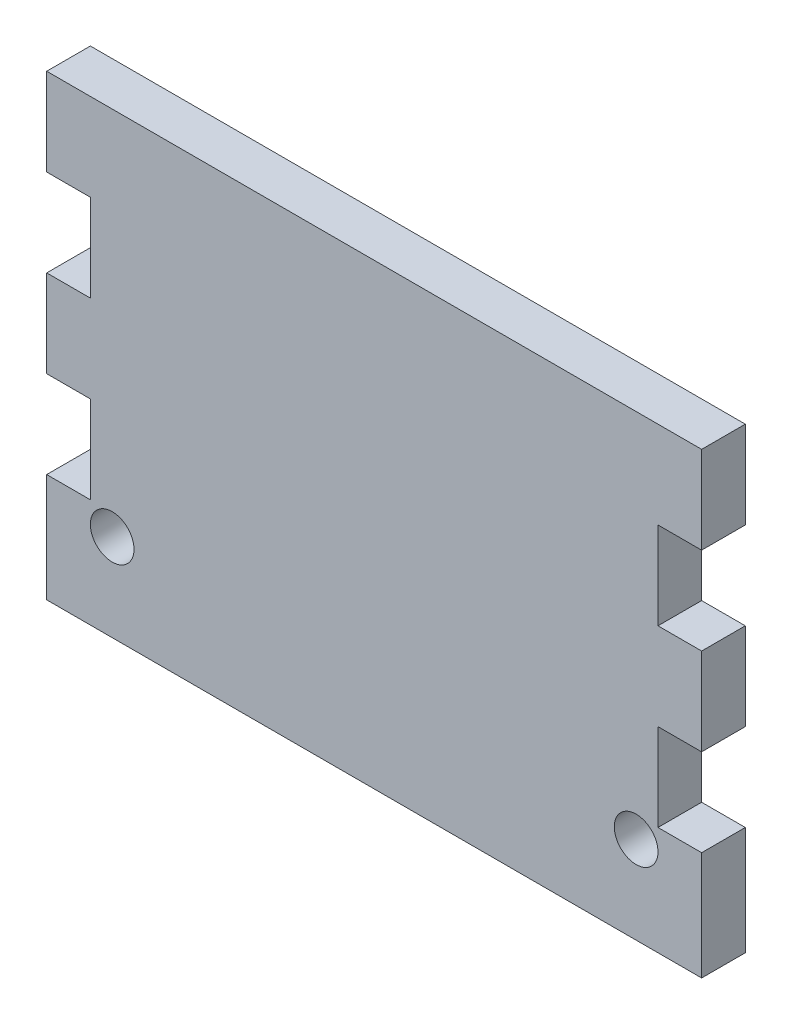
from build123d import *

# Parameters (mm, degrees)
SKETCH2_W           = 95.25
SKETCH2_H           = 305.964286483
BOSS_EXTRUDE1_DEPTH = 6.35
SKETCH3_W           = 6.35
SKETCH3_H           = 12.7
CUT_EXTRUDE1_DEPTH  = 321.51057643
LPATTERN1_COUNT     = 12
LPATTERN1_PITCH     = 25.4
SKETCH4_W           = 15.875
SKETCH4_H           = 6.374255968
SKETCH4_W_2         = 12.7
CUT_EXTRUDE2_DEPTH  = 321.51057643
SKETCH5_W           = 12.7
SKETCH5_H           = 6.929808982
CUT_EXTRUDE3_DEPTH  = 321.51057643
SKETCH8_W           = 95.25
SKETCH8_H           = 0.555553013
CUT_EXTRUDE5_DEPTH  = 321.51057643
SKETCH9_W           = 69.85
SKETCH9_H           = 248.088941691
BOSS_EXTRUDE3_DEPTH = 6.35
CUT_EXTRUDE8_DEPTH  = 321.51057643
FILL_PATTERN1_DEPTH = 6.35
SKETCH9_2_W         = 69.85
SKETCH9_2_H         = 248.088941691
CUT_EXTRUDE9_DEPTH  = 6.35
SKETCH14_W          = 69.85
SKETCH14_H          = 51.238941691
BOSS_EXTRUDE4_DEPTH = 6.35
SKETCH15_W          = 69.85
SKETCH15_H          = 44.888941691
CUT_EXTRUDE11_DEPTH = 6.35
CHAMFER1_SIZE       = 3.175
SKETCH17_W          = 69.85
SKETCH17_H          = 6.35
BOSS_EXTRUDE5_DEPTH = 6.35
SKETCH18_W          = 69.85
SKETCH18_H          = 44.45
CUT_EXTRUDE12_DEPTH = 321.51057643
CHAMFER2_SIZE       = 3.175
SKETCH19_W          = 95.25
SKETCH19_H          = 105.239375395
BOSS_EXTRUDE6_DEPTH = 6.35
LPATTERN2_COUNT     = 5
LPATTERN2_PITCH     = 25.4
SKETCH20_R          = 3.175
CUT_EXTRUDE13_DEPTH = 321.51057643
SKETCH22_R          = 1.75
CUT_EXTRUDE14_DEPTH = 321.51057643
SKETCH23_W          = 95.25
SKETCH23_H          = 344.064286483
CUT_EXTRUDE15_DEPTH = 321.51057643


# Read off the part's stored shape, not the designer's step: Fill Pattern1
with BuildPart() as part:
    # Sketch2 → Boss-Extrude1 (new body)
    with BuildSketch(Plane.XY):
        with Locations((47.625, 152.982143242)):
            Rectangle(SKETCH2_W, SKETCH2_H)
    extrude(amount=BOSS_EXTRUDE1_DEPTH)

    # Sketch3 → Cut-Extrude1 (cut, through all)
    with BuildSketch(Plane.XY.offset(6.35)):
        with Locations((3.175, 19.05)):
            Rectangle(SKETCH3_W, SKETCH3_H)
        with Locations((92.075, 19.05)):
            Rectangle(SKETCH3_W, SKETCH3_H)
    cut_extrude1 = extrude(amount=-CUT_EXTRUDE1_DEPTH, mode=Mode.SUBTRACT)

    # LPattern1: Cut-Extrude1 ×12
    with Locations(*[(0, i * LPATTERN1_PITCH, 0) for i in range(1, LPATTERN1_COUNT)]):
        add(cut_extrude1, mode=Mode.SUBTRACT)

    # Sketch4 → Cut-Extrude2 (cut, through all)
    with BuildSketch(Plane.XY.offset(6.35)):
        with Locations((7.9375, 302.777158499)):
            Rectangle(SKETCH4_W, SKETCH4_H)
        with Locations((34.925, 302.777158499)):
            Rectangle(SKETCH4_W_2, SKETCH4_H)
        with Locations((87.3125, 302.777158499)):
            Rectangle(SKETCH4_W, SKETCH4_H)
        with Locations((60.325, 302.777158499)):
            Rectangle(SKETCH4_W_2, SKETCH4_H)
    extrude(amount=-CUT_EXTRUDE2_DEPTH, mode=Mode.SUBTRACT)

    # Sketch5 → Cut-Extrude3 (cut, through all)
    with BuildSketch(Plane.XY.offset(6.35)):
        with Locations((22.225, 35.336184333)):
            Rectangle(SKETCH5_W, SKETCH5_H)
        with Locations((47.625, 35.336184333)):
            Rectangle(SKETCH5_W, SKETCH5_H)
        with Locations((73.025, 35.336184333)):
            Rectangle(SKETCH5_W, SKETCH5_H)
    extrude(amount=-CUT_EXTRUDE3_DEPTH, mode=Mode.SUBTRACT)

    # Sketch8 → Cut-Extrude5 (cut, through all)
    with BuildSketch(Plane.XY.offset(6.35)):
        with Locations((47.625, 0.277776507)):
            Rectangle(SKETCH8_W, SKETCH8_H)
    extrude(amount=-CUT_EXTRUDE5_DEPTH, mode=Mode.SUBTRACT)

    # Sketch9<2> → Cut-Extrude9 (cut)
    with BuildSketch(Plane.XY.offset(6.35)):
        with Locations((47.625, 169.195559669)):
            Rectangle(SKETCH9_2_W, SKETCH9_2_H)
    extrude(amount=-CUT_EXTRUDE9_DEPTH, mode=Mode.SUBTRACT)


with BuildPart() as body_2:
    # Sketch9 → Boss-Extrude3 (new body)
    with BuildSketch(Plane.XY.offset(6.35)):
        with Locations((47.625, 169.195559669)):
            Rectangle(SKETCH9_W, SKETCH9_H)
    extrude(amount=-BOSS_EXTRUDE3_DEPTH)

    # Sketch12 → Cut-Extrude8 (cut, through all)
    with BuildSketch(Plane.XY.offset(6.35)):
        Polygon((42.125738686, 280.540030515), (36.626477372, 271.015030515), (42.125738686, 261.490030515), (53.124261314, 261.490030515), (58.623522628, 271.015030515), (53.124261314, 280.540030515), align=None)
    extrude(amount=-CUT_EXTRUDE8_DEPTH, mode=Mode.SUBTRACT)

    # Fill Pattern1 outline → Fill Pattern1 (cut)
    with BuildSketch(Plane.XY):
        Polygon((75.12130657, 223.390030515), (80.620567884, 232.915030515), (75.12130657, 242.440030515), (64.122783942, 242.440030515), (58.623522628, 232.915030515), (64.122783942, 223.390030515), align=None)
        Polygon((20.12869343, 223.390030515), (31.127216058, 223.390030515), (36.626477372, 232.915030515), (31.127216058, 242.440030515), (20.12869343, 242.440030515), (14.629432116, 232.915030515), align=None)
        Polygon((12.7, 198.156904969), (12.7, 191.47315606), (14.629432116, 194.815030515), align=None)
        Polygon((14.629432116, 169.415030515), (12.7, 172.756904969), (12.7, 166.07315606), align=None)
        Polygon((12.7, 223.556904969), (12.7, 216.87315606), (14.629432116, 220.215030515), align=None)
        Polygon((14.629432116, 144.015030515), (12.7, 147.356904969), (12.7, 140.67315606), align=None)
        Polygon((12.7, 248.956904969), (12.7, 242.27315606), (14.629432116, 245.615030515), align=None)
        Polygon((14.629432116, 118.615030515), (12.7, 121.956904969), (12.7, 115.27315606), align=None)
        Polygon((12.7, 274.356904969), (12.7, 267.67315606), (14.629432116, 271.015030515), align=None)
        Polygon((14.629432116, 93.215030515), (12.7, 96.556904969), (12.7, 89.87315606), align=None)
        Polygon((12.7, 293.240030515), (12.7, 293.07315606), (12.796345011, 293.240030515), align=None)
        Polygon((14.629432116, 67.815030515), (12.7, 71.156904969), (12.7, 64.47315606), align=None)
        Polygon((31.127216058, 293.240030515), (20.12869343, 293.240030515), (14.629432116, 283.715030515), (20.12869343, 274.190030515), (31.127216058, 274.190030515), (36.626477372, 283.715030515), align=None)
        Polygon((56.790435523, 293.240030515), (38.459564477, 293.240030515), (42.125738686, 286.890030515), (53.124261314, 286.890030515), align=None)
        Polygon((42.125738686, 51.940030515), (38.206141373, 45.151088824), (57.043858627, 45.151088824), (53.124261314, 51.940030515), align=None)
        Polygon((75.12130657, 293.240030515), (64.122783942, 293.240030515), (58.623522628, 283.715030515), (64.122783942, 274.190030515), (75.12130657, 274.190030515), (80.620567884, 283.715030515), align=None)
        Polygon((82.55, 45.756904969), (82.200231885, 45.151088824), (82.55, 45.151088824), align=None)
        Polygon((82.55, 293.240030515), (82.453654989, 293.240030515), (82.55, 293.07315606), align=None)
        Polygon((80.620567884, 67.815030515), (82.55, 64.47315606), (82.55, 71.156904969), align=None)
        Polygon((82.55, 267.67315606), (82.55, 274.356904969), (80.620567884, 271.015030515), align=None)
        Polygon((80.620567884, 93.215030515), (82.55, 89.87315606), (82.55, 96.556904969), align=None)
        Polygon((82.55, 242.27315606), (82.55, 248.956904969), (80.620567884, 245.615030515), align=None)
        Polygon((80.620567884, 118.615030515), (82.55, 115.27315606), (82.55, 121.956904969), align=None)
        Polygon((82.55, 216.87315606), (82.55, 223.556904969), (80.620567884, 220.215030515), align=None)
        Polygon((80.620567884, 144.015030515), (82.55, 140.67315606), (82.55, 147.356904969), align=None)
        Polygon((82.55, 191.47315606), (82.55, 198.156904969), (80.620567884, 194.815030515), align=None)
        Polygon((80.620567884, 169.415030515), (82.55, 166.07315606), (82.55, 172.756904969), align=None)
        Polygon((20.12869343, 248.790030515), (31.127216058, 248.790030515), (36.626477372, 258.315030515), (31.127216058, 267.840030515), (20.12869343, 267.840030515), (14.629432116, 258.315030515), align=None)
        Polygon((64.122783942, 267.840030515), (58.623522628, 258.315030515), (64.122783942, 248.790030515), (75.12130657, 248.790030515), (80.620567884, 258.315030515), (75.12130657, 267.840030515), align=None)
        Polygon((42.125738686, 236.090030515), (53.124261314, 236.090030515), (58.623522628, 245.615030515), (53.124261314, 255.140030515), (42.125738686, 255.140030515), (36.626477372, 245.615030515), align=None)
        Polygon((20.12869343, 197.990030515), (31.127216058, 197.990030515), (36.626477372, 207.515030515), (31.127216058, 217.040030515), (20.12869343, 217.040030515), (14.629432116, 207.515030515), align=None)
        Polygon((53.124261314, 204.340030515), (42.125738686, 204.340030515), (36.626477372, 194.815030515), (42.125738686, 185.290030515), (53.124261314, 185.290030515), (58.623522628, 194.815030515), align=None)
        Polygon((31.127216058, 166.240030515), (20.12869343, 166.240030515), (14.629432116, 156.715030515), (20.12869343, 147.190030515), (31.127216058, 147.190030515), (36.626477372, 156.715030515), align=None)
        Polygon((75.12130657, 197.990030515), (80.620567884, 207.515030515), (75.12130657, 217.040030515), (64.122783942, 217.040030515), (58.623522628, 207.515030515), (64.122783942, 197.990030515), align=None)
        Polygon((42.125738686, 210.690030515), (53.124261314, 210.690030515), (58.623522628, 220.215030515), (53.124261314, 229.740030515), (42.125738686, 229.740030515), (36.626477372, 220.215030515), align=None)
        Polygon((20.12869343, 172.590030515), (31.127216058, 172.590030515), (36.626477372, 182.115030515), (31.127216058, 191.640030515), (20.12869343, 191.640030515), (14.629432116, 182.115030515), align=None)
        Polygon((53.124261314, 178.940030515), (42.125738686, 178.940030515), (36.626477372, 169.415030515), (42.125738686, 159.890030515), (53.124261314, 159.890030515), (58.623522628, 169.415030515), align=None)
        Polygon((31.127216058, 140.840030515), (20.12869343, 140.840030515), (14.629432116, 131.315030515), (20.12869343, 121.790030515), (31.127216058, 121.790030515), (36.626477372, 131.315030515), align=None)
        Polygon((75.12130657, 147.190030515), (80.620567884, 156.715030515), (75.12130657, 166.240030515), (64.122783942, 166.240030515), (58.623522628, 156.715030515), (64.122783942, 147.190030515), align=None)
        Polygon((75.12130657, 172.590030515), (80.620567884, 182.115030515), (75.12130657, 191.640030515), (64.122783942, 191.640030515), (58.623522628, 182.115030515), (64.122783942, 172.590030515), align=None)
        Polygon((53.124261314, 153.540030515), (42.125738686, 153.540030515), (36.626477372, 144.015030515), (42.125738686, 134.490030515), (53.124261314, 134.490030515), (58.623522628, 144.015030515), align=None)
        Polygon((31.127216058, 115.440030515), (20.12869343, 115.440030515), (14.629432116, 105.915030515), (20.12869343, 96.390030515), (31.127216058, 96.390030515), (36.626477372, 105.915030515), align=None)
        Polygon((75.12130657, 121.790030515), (80.620567884, 131.315030515), (75.12130657, 140.840030515), (64.122783942, 140.840030515), (58.623522628, 131.315030515), (64.122783942, 121.790030515), align=None)
        Polygon((53.124261314, 128.140030515), (42.125738686, 128.140030515), (36.626477372, 118.615030515), (42.125738686, 109.090030515), (53.124261314, 109.090030515), (58.623522628, 118.615030515), align=None)
        Polygon((31.127216058, 90.040030515), (20.12869343, 90.040030515), (14.629432116, 80.515030515), (20.12869343, 70.990030515), (31.127216058, 70.990030515), (36.626477372, 80.515030515), align=None)
        Polygon((75.12130657, 96.390030515), (80.620567884, 105.915030515), (75.12130657, 115.440030515), (64.122783942, 115.440030515), (58.623522628, 105.915030515), (64.122783942, 96.390030515), align=None)
        Polygon((53.124261314, 102.740030515), (42.125738686, 102.740030515), (36.626477372, 93.215030515), (42.125738686, 83.690030515), (53.124261314, 83.690030515), (58.623522628, 93.215030515), align=None)
        Polygon((31.127216058, 64.640030515), (20.12869343, 64.640030515), (14.629432116, 55.115030515), (20.12869343, 45.590030515), (31.127216058, 45.590030515), (36.626477372, 55.115030515), align=None)
        Polygon((75.12130657, 70.990030515), (80.620567884, 80.515030515), (75.12130657, 90.040030515), (64.122783942, 90.040030515), (58.623522628, 80.515030515), (64.122783942, 70.990030515), align=None)
        Polygon((53.124261314, 77.340030515), (42.125738686, 77.340030515), (36.626477372, 67.815030515), (42.125738686, 58.290030515), (53.124261314, 58.290030515), (58.623522628, 67.815030515), align=None)
        Polygon((75.12130657, 45.590030515), (80.620567884, 55.115030515), (75.12130657, 64.640030515), (64.122783942, 64.640030515), (58.623522628, 55.115030515), (64.122783942, 45.590030515), align=None)
    extrude(amount=FILL_PATTERN1_DEPTH, mode=Mode.SUBTRACT)

    # Combine1: union part
    add(part.part)

    # Sketch14 → Boss-Extrude4 (add, through all)
    with BuildSketch(Plane.XY.offset(6.35)):
        with Locations((47.625, 70.77055967)):
            Rectangle(SKETCH14_W, SKETCH14_H)
    extrude(amount=-BOSS_EXTRUDE4_DEPTH)

    # Sketch15 → Cut-Extrude11 (cut)
    with BuildSketch(Plane.XY.offset(6.35)):
        with Locations((47.625, 67.59555967)):
            Rectangle(SKETCH15_W, SKETCH15_H)
    extrude(amount=-CUT_EXTRUDE11_DEPTH, mode=Mode.SUBTRACT)

    # Chamfer1
    chamfer1_edges = [body_2.edges().sort_by_distance(p)[0] for p in [
        (12.7, 45.151088824, 3.175),
        (12.7, 90.040030515, 3.175),
        (82.55, 90.040030515, 3.175),
        (82.55, 45.151088824, 3.175),
    ]]
    chamfer(chamfer1_edges, length=CHAMFER1_SIZE)

    # Sketch17 → Boss-Extrude5 (add, through all)
    with BuildSketch(Plane.XY.offset(6.35)):
        with Locations((47.625, 245.615030515)):
            Rectangle(SKETCH17_W, SKETCH17_H)
    extrude(amount=-BOSS_EXTRUDE5_DEPTH)

    # Sketch18 → Cut-Extrude12 (cut, through all)
    with BuildSketch(Plane.XY.offset(6.35)):
        with Locations((47.625, 271.015030515)):
            Rectangle(SKETCH18_W, SKETCH18_H)
    extrude(amount=-CUT_EXTRUDE12_DEPTH, mode=Mode.SUBTRACT)

    # Chamfer2
    chamfer2_edges = [body_2.edges().sort_by_distance(p)[0] for p in [
        (82.55, 293.240030515, 3.175),
        (12.7, 293.240030515, 3.175),
        (12.7, 248.790030515, 3.175),
        (82.55, 248.790030515, 3.175),
    ]]
    chamfer(chamfer2_edges, length=CHAMFER2_SIZE)

    # Sketch19 → Boss-Extrude6 (add)
    with BuildSketch(Plane.XY.offset(6.35)):
        with Locations((47.625, -52.064134685)):
            Rectangle(SKETCH19_W, SKETCH19_H)
    extrude(amount=-BOSS_EXTRUDE6_DEPTH)

    # LPattern2: Cut-Extrude1 ×5
    with Locations(*[(0, -i * LPATTERN2_PITCH, 0) for i in range(1, LPATTERN2_COUNT)]):
        add(cut_extrude1, mode=Mode.SUBTRACT)

    # Sketch20 → Cut-Extrude13 (cut, through all)
    with BuildSketch(Plane.XY.offset(6.35)):
        with Locations((9.525, -91.983822382)):
            Circle(SKETCH20_R)
        with Locations((85.725, -91.983822382)):
            Circle(SKETCH20_R)
    extrude(amount=-CUT_EXTRUDE13_DEPTH, mode=Mode.SUBTRACT)

    # Sketch22 → Cut-Extrude14 (cut, through all)
    with BuildSketch(Plane.XY.offset(6.35)):
        with Locations((25.4, 0)):
            Circle(SKETCH22_R)
        with Locations((69.85, 0)):
            Circle(SKETCH22_R)
    extrude(amount=-CUT_EXTRUDE14_DEPTH, mode=Mode.SUBTRACT)

    # Sketch23 → Cut-Extrude15 (cut, through all)
    with BuildSketch(Plane.XY.offset(6.35)):
        with Locations((47.625, 133.932143242)):
            Rectangle(SKETCH23_W, SKETCH23_H)
    extrude(amount=-CUT_EXTRUDE15_DEPTH, mode=Mode.SUBTRACT)


solid = body_2.part
